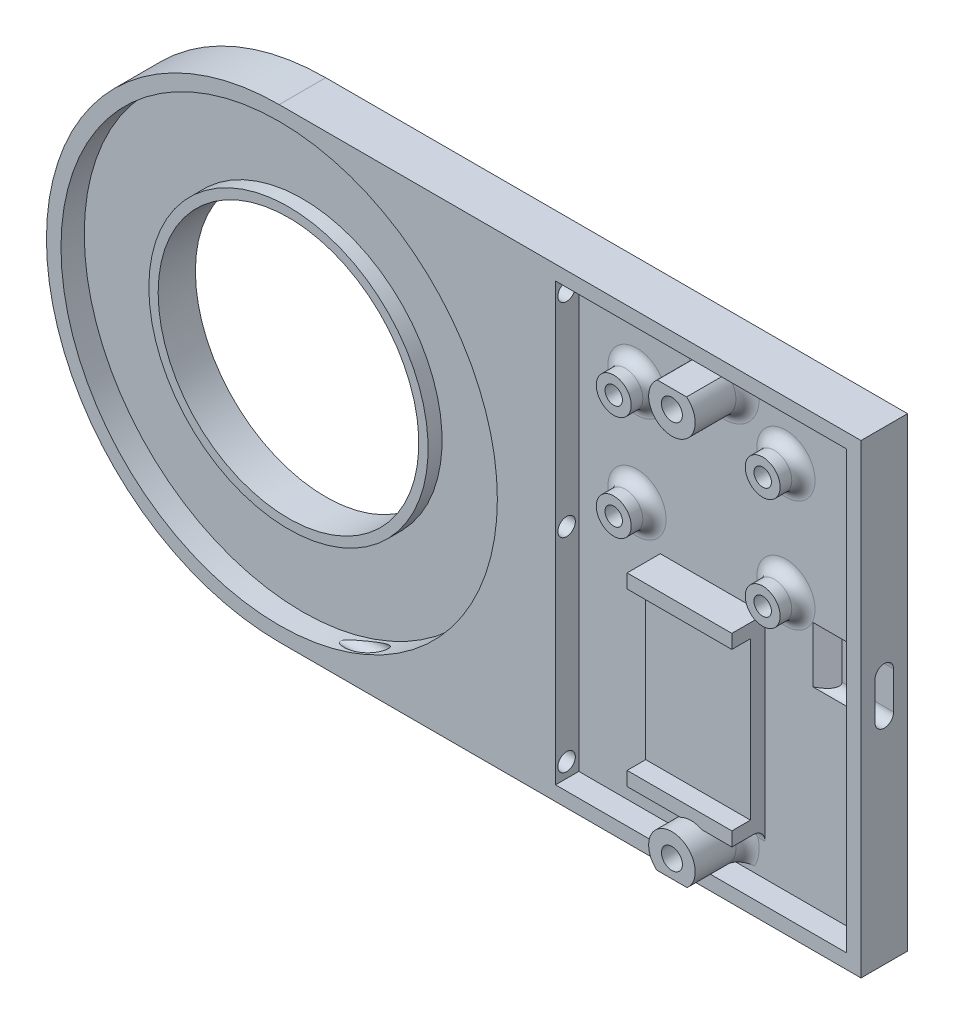
from build123d import *

# Parameters (mm, degrees)
SKETCH1_R            = 15.24
BOSS_EXTRUDE1_DEPTH  = 2.54
BOSS_EXTRUDE2_DEPTH  = 2.54
BOSS_EXTRUDE3_DEPTH  = 2.54
SKETCH4_R            = 0.9525
CUT_EXTRUDE1_DEPTH   = 31.75
SKETCH8_R            = 1.905
BOSS_EXTRUDE5_DEPTH  = 2.54
SKETCH9_R            = 0.9525
CUT_EXTRUDE2_DEPTH   = 3.81
SKETCH11_W           = 11.43
SKETCH11_H           = 17.145
BOSS_EXTRUDE6_DEPTH  = 1.5875
SKETCH12_W           = 11.43
SKETCH12_H           = 1.524
BOSS_EXTRUDE12_DEPTH = 3.6195
SKETCH13_R           = 2.54
BOSS_EXTRUDE13_DEPTH = 5.715
SKETCH14_R           = 1.143
CUT_EXTRUDE3_DEPTH   = 6.731
CUT_EXTRUDE4_DEPTH   = 5.08
CHAMFER1_START       = 55.696476211
CHAMFER1_DEPTH       = 2.723523789
CHAMFER1_START_2     = 24.919561029
CHAMFER1_2_DEPTH     = 0.920808711
SKETCH16_R           = 15.24
SKETCH16_R_2         = 14.224
BOSS_EXTRUDE14_DEPTH = 4.064
SKETCH17_W           = 31.75
SKETCH17_H           = 0.635
CUT_EXTRUDE5_DEPTH   = 5.715
FILLET1_R            = 1.27


with BuildPart() as part:
    # Sketch1 → Boss-Extrude1 (new body)
    with BuildSketch(Plane.XY):
        with BuildLine():
            Line((0, 25.4), (63.5, 25.4))
            Line((63.5, 25.4), (63.5, -25.4))
            Line((63.5, -25.4), (0, -25.4))
            ThreePointArc((0, -25.4), (-25.4, 0), (0, 25.4))
        make_face()
        Circle(SKETCH1_R, mode=Mode.SUBTRACT)
    extrude(amount=BOSS_EXTRUDE1_DEPTH)

    # Sketch2 → Boss-Extrude2 (add)
    with BuildSketch(Plane.XY.offset(2.54)):
        with BuildLine():
            Line((63.5, -25.4), (63.5, 25.4))
            Line((63.5, 25.4), (0, 25.4))
            ThreePointArc((0, 25.4), (-25.4, 0), (0, -25.4))
            Line((0, -25.4), (63.5, -25.4))
        make_face()
        with BuildLine():
            Line((0, -23.8125), (61.9125, -23.8125))
            Line((61.9125, -23.8125), (61.9125, 23.8125))
            Line((61.9125, 23.8125), (0, 23.8125))
            ThreePointArc((0, 23.8125), (-23.8125, 0), (0, -23.8125))
        make_face(mode=Mode.SUBTRACT)
    extrude(amount=BOSS_EXTRUDE2_DEPTH)

    # Sketch3 → Boss-Extrude3 (add)
    with BuildSketch(Plane.XY.offset(2.54)):
        with BuildLine():
            Line((30.1625, 23.8125), (30.1625, -23.8125))
            Line((30.1625, -23.8125), (0, -23.8125))
            ThreePointArc((0, -23.8125), (23.8125, 0), (0, 23.8125))
            Line((0, 23.8125), (30.1625, 23.8125))
        make_face()
    extrude(amount=BOSS_EXTRUDE3_DEPTH)

    # Sketch4 → Cut-Extrude1 (cut)
    with BuildSketch(Plane(origin=(30.1625, 0, 0), x_dir=(0, 0, -1), z_dir=(1, 0, 0))):
        with Locations((-3.8735, 22.225)):
            Circle(SKETCH4_R)
        with Locations((-3.8735, 0)):
            Circle(SKETCH4_R)
        with Locations((-3.8735, -22.225)):
            Circle(SKETCH4_R)
    extrude(amount=-CUT_EXTRUDE1_DEPTH, mode=Mode.SUBTRACT)

    # Sketch8 → Boss-Extrude5 (add)
    with BuildSketch(Plane.XY.offset(2.54)):
        with Locations((52.7685, 4.3815)):
            Circle(SKETCH8_R)
        with Locations((36.5125, 4.7625)):
            Circle(SKETCH8_R)
        with Locations((36.5125, 16.1925)):
            Circle(SKETCH8_R)
        with Locations((52.7685, 16.5735)):
            Circle(SKETCH8_R)
    extrude(amount=BOSS_EXTRUDE5_DEPTH)

    # Sketch9 → Cut-Extrude2 (cut)
    with BuildSketch(Plane.XY.offset(5.08)):
        with Locations((52.7685, 4.3815)):
            Circle(SKETCH9_R)
        with Locations((36.5125, 4.7625)):
            Circle(SKETCH9_R)
        with Locations((52.7685, 16.5735)):
            Circle(SKETCH9_R)
        with Locations((36.5125, 16.1925)):
            Circle(SKETCH9_R)
    extrude(amount=-CUT_EXTRUDE2_DEPTH, mode=Mode.SUBTRACT)

    # Sketch11 → Boss-Extrude6 (add)
    with BuildSketch(Plane.XY.offset(2.54)):
        with Locations((44.7675, -8.89)):
            Rectangle(SKETCH11_W, SKETCH11_H)
    extrude(amount=BOSS_EXTRUDE6_DEPTH)

    # Sketch12 → Boss-Extrude12 (add)
    with BuildSketch(Plane.XY.offset(2.54)):
        with Locations((44.7675, 0.4445)):
            Rectangle(SKETCH12_W, SKETCH12_H)
        with Locations((44.7675, -18.2245)):
            Rectangle(SKETCH12_W, SKETCH12_H)
    extrude(amount=BOSS_EXTRUDE12_DEPTH)

    # Sketch13 → Boss-Extrude13 (add)
    with BuildSketch(Plane.XY.offset(2.54)):
        with Locations((46.0375, 21.204369066)):
            Circle(SKETCH13_R)
        with Locations(Location((46.0375, -21.247882569, 0), (0, 0, 117.088012104))):
            Circle(SKETCH13_R)
    extrude(amount=BOSS_EXTRUDE13_DEPTH)

    # Sketch14 → Cut-Extrude3 (cut)
    with BuildSketch(Plane.XY.offset(8.255)):
        with Locations((46.0375, -21.247882569)):
            Circle(SKETCH14_R)
        with Locations((46.0375, 21.204369066)):
            Circle(SKETCH14_R)
    extrude(amount=-CUT_EXTRUDE3_DEPTH, mode=Mode.SUBTRACT)

    # Sketch15 → Cut-Extrude4 (cut)
    with BuildSketch(Plane(origin=(63.5, 0, 0), x_dir=(0, 0, -1), z_dir=(1, 0, 0))):
        with BuildLine():
            Line((-3.556, -2.032), (-3.556, 2.032))
            ThreePointArc((-3.556, 2.032), (-2.54, 3.048), (-1.524, 2.032))
            Line((-1.524, 2.032), (-1.524, -2.032))
            ThreePointArc((-1.524, -2.032), (-2.54, -3.048), (-3.556, -2.032))
        make_face()
    extrude(amount=-CUT_EXTRUDE4_DEPTH, mode=Mode.SUBTRACT)

    # Chamfer1: read off the stored shape, not the designer's step
    # Chamfer1 outline → Chamfer1 (cut)
    with BuildSketch(Plane.YZ.offset(CHAMFER1_START)):
        with BuildLine():
            ThreePointArc((-3.048, 2.54), (-2.75042049, 1.82157951), (-2.032, 1.524))
            Line((-2.032, 1.524), (2.032, 1.524))
            ThreePointArc((2.032, 1.524), (2.75042049, 1.82157951), (3.048, 2.54))
            Line((3.048, 2.54), (-3.048, 2.54))
        make_face()
    extrude(amount=CHAMFER1_DEPTH, mode=Mode.SUBTRACT)

    # Chamfer1 2 outline → Chamfer1 2 (add)
    with BuildSketch(Plane(origin=(0, 0, 0), x_dir=(0.9063077870366516, 0, -0.42261826174069594), z_dir=(0.4226182617406959, 0, 0.9063077870366517)).offset(CHAMFER1_START_2)):
        with BuildLine():
            add(Edge.make_bspline(
                [(51.808760524, -2.032), (51.808760524, -3.048), (49.404699716, -3.048)],
                knots=[0, 0, 0, 1.570796327, 1.570796327, 1.570796327], degree=2, weights=[1, 0.707106781, 1]))
            Line((51.808760524, -2.032), (51.808760524, 2.032))
            add(Edge.make_bspline(
                [(49.404699716, 3.048), (51.808760524, 3.048), (51.808760524, 2.032)],
                knots=[4.71238898, 4.71238898, 4.71238898, 6.283185307, 6.283185307, 6.283185307], degree=2, weights=[1, 0.707106781, 1]))
            Line((49.404699716, 3.048), (49.404699716, -3.048))
        make_face()
    extrude(amount=CHAMFER1_2_DEPTH)

    # Sketch16 → Boss-Extrude14 (add)
    with BuildSketch(Plane(origin=(0, 0, 0), x_dir=(-1, 0, 0), z_dir=(0, 0, -1))):
        Circle(SKETCH16_R)
        Circle(SKETCH16_R_2, mode=Mode.SUBTRACT)
    extrude(amount=-BOSS_EXTRUDE14_DEPTH)

    # Sketch17 → Cut-Extrude5 (cut)
    with BuildSketch(Plane.XY.offset(2.54)):
        with Locations((46.0375, 23.495)):
            Rectangle(SKETCH17_W, SKETCH17_H)
        with Locations((46.0375, -23.495)):
            Rectangle(SKETCH17_W, SKETCH17_H)
    extrude(amount=CUT_EXTRUDE5_DEPTH, mode=Mode.SUBTRACT)

    # Fillet1
    fillet1_edges = [part.edges().sort_by_distance(p)[0] for p in [
        (41.966694528, -18.9865, 2.54),
        (48.838305472, -18.9865, 2.54),
        (43.515040901, -20.949889126, 2.54),
        (48.559959099, -20.949889126, 2.54),
        (46.0375, 18.664369066, 2.54),
        (50.8635, 4.3815, 2.54),
        (34.6075, 4.7625, 2.54),
        (34.6075, 16.1925, 2.54),
        (50.8635, 16.5735, 2.54),
    ]]
    fillet(fillet1_edges, radius=FILLET1_R)


solid = part.part
